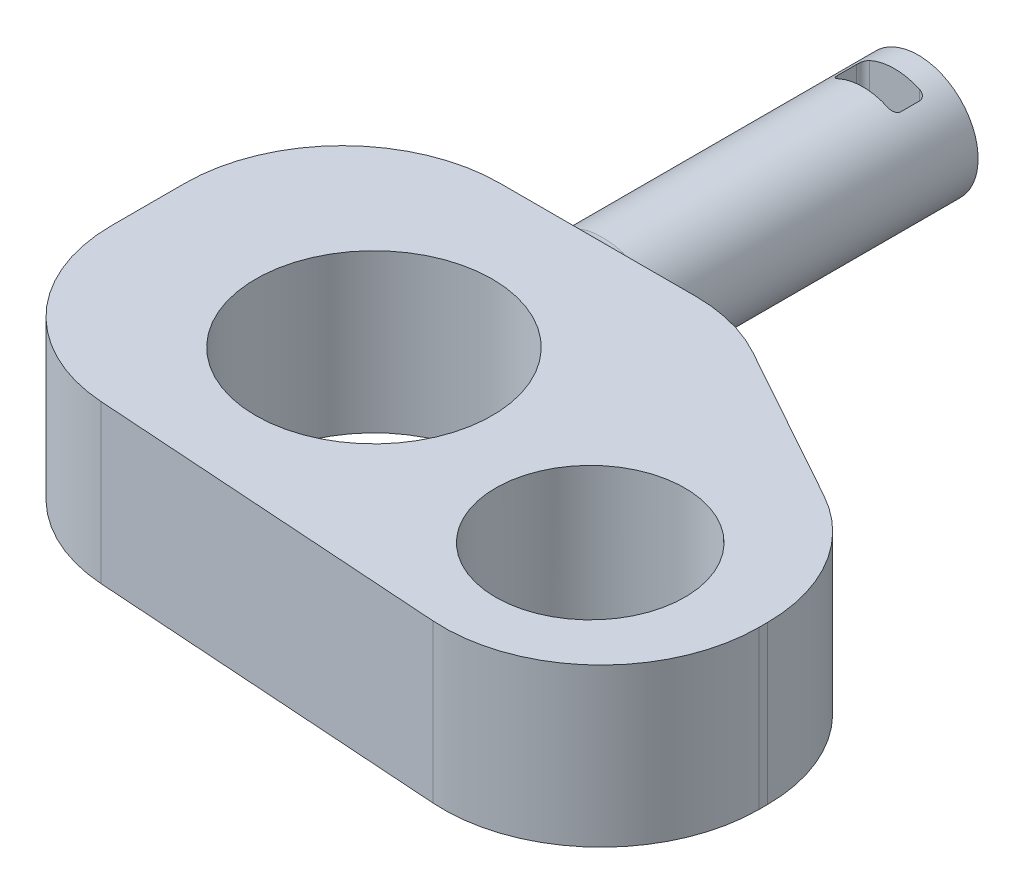
from build123d import *

# Parameters (mm, degrees)
SKETCH1_R           = 5
BOSS_EXTRUDE1_DEPTH = 20
SKETCH2_R           = 5
SKETCH2_R_2         = 3.98
CUT_EXTRUDE2_DEPTH  = 8
SKETCH8_R           = 5
BOSS_EXTRUDE2_DEPTH = 20
BOSS_EXTRUDE3_START = -31.5
BOSS_EXTRUDE3_DEPTH = 31.5
BOSS_EXTRUDE4_START = -31.5
BOSS_EXTRUDE4_DEPTH = 31.5
SKETCH12_R          = 7.5
SKETCH12_R_2        = 6
CUT_EXTRUDE3_DEPTH  = 31.5
CUT_EXTRUDE4_DEPTH  = 55.083269132
FILLET1_R           = 10
BOSS_EXTRUDE5_START = 13
SKETCH17_R          = 3.98
BOSS_EXTRUDE5_DEPTH = 13
CUT_EXTRUDE5_DEPTH  = 46.417762115
SKETCH19_R          = 5
SKETCH19_R_2        = 3.98
CUT_EXTRUDE6_DEPTH  = 0.5
SKETCH20_R          = 3.98
SKETCH20_R_2        = 3.8
CUT_EXTRUDE7_DEPTH  = 21.5
FILLET2_R           = 1.5


with BuildPart() as part:
    # Sketch1 → Boss-Extrude1 (new body)
    with BuildSketch(Plane.XY):
        Circle(SKETCH1_R)
    extrude(amount=BOSS_EXTRUDE1_DEPTH)

    # Sketch2 → Cut-Extrude2 (cut)
    with BuildSketch(Plane(origin=(0, 0, 0), x_dir=(-1, 0, 0), z_dir=(0, 0, -1))):
        Circle(SKETCH2_R)
        Circle(SKETCH2_R_2, mode=Mode.SUBTRACT)
    extrude(amount=-CUT_EXTRUDE2_DEPTH, mode=Mode.SUBTRACT)

    # Sketch8 → Boss-Extrude2 (add)
    with BuildSketch(Plane.XY.offset(20)):
        with Locations(Location((0, 0, 0), (0, 0, 180))):
            Circle(SKETCH8_R)
    extrude(amount=BOSS_EXTRUDE2_DEPTH)

    # Sketch9 → Boss-Extrude3 (add)
    with BuildSketch(Plane.XY.offset(40).offset(BOSS_EXTRUDE3_START)):
        with BuildLine():
            Line((0, 5), (35, 5))
            Line((35, 5), (35, -5))
            Line((35, -5), (0, -5))
            ThreePointArc((0, -5), (5, 0), (0, 5))
        make_face()
    extrude(amount=BOSS_EXTRUDE3_DEPTH)

    # Sketch10 → Boss-Extrude4 (add)
    with BuildSketch(Plane.XY.offset(40).offset(BOSS_EXTRUDE4_START)):
        with BuildLine():
            ThreePointArc((0, -5), (-5, 0), (0, 5))
            Line((0, 5), (-15, 5))
            Line((-15, 5), (-15, -5))
            Line((-15, -5), (0, -5))
        make_face()
    extrude(amount=BOSS_EXTRUDE4_DEPTH)

    # Sketch12 → Cut-Extrude3 (cut)
    with BuildSketch(Plane(origin=(0, 5, 0), x_dir=(1, 0, 0), z_dir=(0, 1, 0))):
        with Locations(Location((0, -21.5, 0), (0, 0, 270))):
            Circle(SKETCH12_R)
        with Locations(Location((17.579426131, -25.368304137, 0), (0, 0, 270))):
            Circle(SKETCH12_R_2)
    extrude(amount=-CUT_EXTRUDE3_DEPTH, mode=Mode.SUBTRACT)

    # Sketch14 → Cut-Extrude4 (cut, through all)
    with BuildSketch(Plane(origin=(0, 5, 0), x_dir=(1, 0, 0), z_dir=(0, 1, 0))):
        Polygon((-15, -40), (35, -40), (35, -37.368304137), (35, -8.5), (10, -8.5), (27.579426131, -18.251873125), (27.579426131, -35.368304137), (-15, -32.5), align=None)
    extrude(amount=-CUT_EXTRUDE4_DEPTH, mode=Mode.SUBTRACT)

    # Fillet1
    fillet1_edges = [part.edges().sort_by_distance(p)[0] for p in [
        (-15, 0, 8.5),
        (27.579426131, 0, 18.251873125),
        (10, 0, 8.5),
        (-15, 0, 32.5),
        (27.579426131, 0, 35.368304137),
    ]]
    fillet(fillet1_edges, radius=FILLET1_R - 0.0001)  # a hair under: the kernel refuses the full size

    # Sketch17 → Boss-Extrude5 (add)
    with BuildSketch(Plane(origin=(0, 0, 0), x_dir=(-1, 0, 0), z_dir=(0, 0, -1)).offset(BOSS_EXTRUDE5_START)):
        Circle(SKETCH17_R)
    extrude(amount=-BOSS_EXTRUDE5_DEPTH)

    # Sketch18 → Cut-Extrude5 (cut, through all)
    with BuildSketch(Plane(origin=(0, 5, 0), x_dir=(1, 0, 0), z_dir=(0, 1, 0))):
        with BuildLine():
            Line((-1.6, 11.5), (1.6, 11.5))
            ThreePointArc((1.6, 11.5), (1.882842712, 11.382842712), (2, 11.1))
            Line((2, 11.1), (2, 9.9))
            ThreePointArc((2, 9.9), (1.882842712, 9.617157288), (1.6, 9.5))
            Line((1.6, 9.5), (-1.6, 9.5))
            ThreePointArc((-1.6, 9.5), (-1.882842712, 9.617157288), (-2, 9.9))
            Line((-2, 9.9), (-2, 11.1))
            ThreePointArc((-2, 11.1), (-1.882842712, 11.382842712), (-1.6, 11.5))
        make_face()
    extrude(amount=-CUT_EXTRUDE5_DEPTH, mode=Mode.SUBTRACT)

    # Sketch19 → Cut-Extrude6 (cut)
    with BuildSketch(Plane(origin=(0, 0, 8), x_dir=(-1, 0, 0), z_dir=(0, 0, -1))):
        Circle(SKETCH19_R)
        Circle(SKETCH19_R_2, mode=Mode.SUBTRACT)
    extrude(amount=-CUT_EXTRUDE6_DEPTH, mode=Mode.SUBTRACT)

    # Sketch20 → Cut-Extrude7 (cut)
    with BuildSketch(Plane(origin=(0, 0, -13), x_dir=(-1, 0, 0), z_dir=(0, 0, -1))):
        Circle(SKETCH20_R)
        Circle(SKETCH20_R_2, mode=Mode.SUBTRACT)
    extrude(amount=-CUT_EXTRUDE7_DEPTH, mode=Mode.SUBTRACT)

    # Fillet2
    fillet2_edges = [part.edges().sort_by_distance(p)[0] for p in [
        (3.8, 0, 8.5),
    ]]
    fillet(fillet2_edges, radius=FILLET2_R)


solid = part.part
